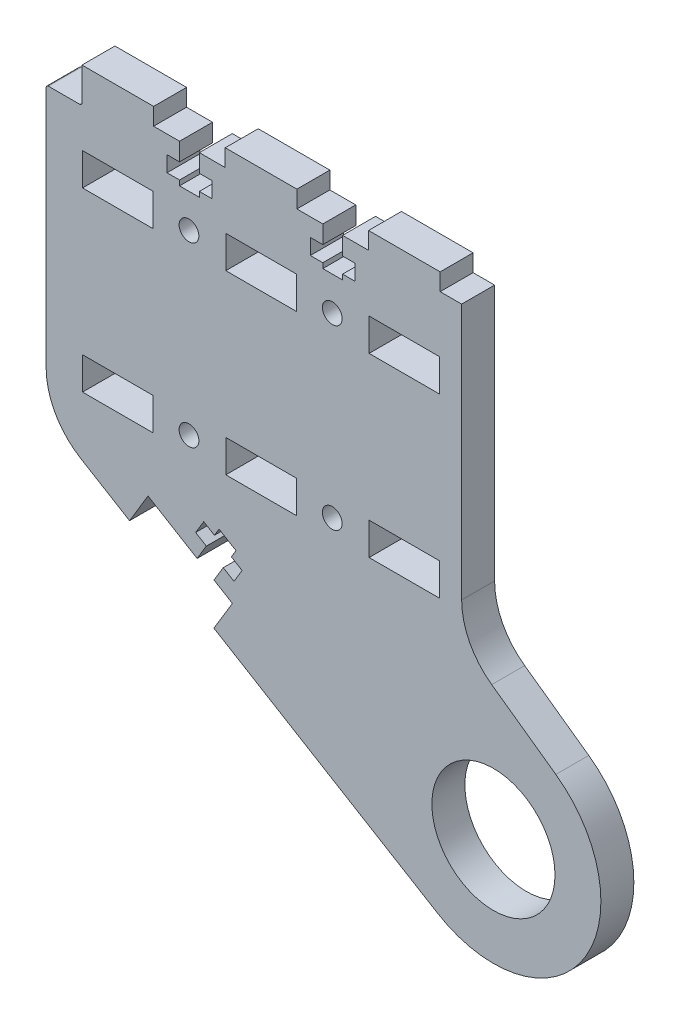
from build123d import *

# Parameters (mm, degrees)
SKETCH1_R           = 10.9125
SKETCH1_W           = 12.5
SKETCH1_H           = 5.742
SKETCH1_R_2         = 1.7526
BOSS_EXTRUDE1_DEPTH = 5.842
FILLET10_R          = 12.7
FILLET11_R          = 12.7
CUT_EXTRUDE9_DEPTH  = 93.478414179
FILLET12_R          = 12.7
SKETCH17_W          = 6.349990563
SKETCH17_H          = 3.175
CUT_EXTRUDE10_DEPTH = 93.478414179
FILLET13_R          = 0.4
CUT_EXTRUDE11_DEPTH = 93.478414179


with BuildPart() as part:
    # Sketch1 → Boss-Extrude1 (new body)
    with BuildSketch(Plane.XY):
        with BuildLine():
            Line((38.179644021, -25.196), (38.179644021, -12.853632574))
            Line((38.179644021, -12.853632574), (38.179644021, 12.853632574))
            Line((38.179644021, 12.853632574), (38.179644021, 28.575))
            Line((38.179644021, 28.575), (31.829653458, 28.575))
            Line((31.829653458, 28.575), (31.829653458, 31.623))
            Line((31.829653458, 31.623), (19.129653458, 31.623))
            Line((19.129653458, 31.623), (19.129653458, 28.575))
            Line((19.129653458, 28.575), (14.532253458, 28.575))
            Line((14.532253458, 28.575), (14.532253458, 25.4))
            Line((14.532253458, 25.4), (16.748403458, 25.4))
            Line((16.748403458, 25.4), (16.748403458, 22.621875))
            Line((16.748403458, 22.621875), (14.532253458, 22.621875))
            Line((14.532253458, 22.621875), (14.532253458, 21.717))
            Line((14.532253458, 21.717), (11.027053458, 21.717))
            Line((11.027053458, 21.717), (11.027053458, 22.621875))
            Line((11.027053458, 22.621875), (8.810903458, 22.621875))
            Line((8.810903458, 22.621875), (8.810903458, 25.4))
            Line((8.810903458, 25.4), (11.027053458, 25.4))
            Line((11.027053458, 25.4), (11.027053458, 28.575))
            Line((11.027053458, 28.575), (6.429653458, 28.575))
            Line((6.429653458, 28.575), (6.429653458, 31.623))
            Line((6.429653458, 31.623), (-6.270346542, 31.623))
            Line((-6.270346542, 31.623), (-6.270346542, 28.575))
            Line((-6.270346542, 28.575), (-10.867746542, 28.575))
            Line((-10.867746542, 28.575), (-10.867746542, 25.4))
            Line((-10.867746542, 25.4), (-8.651596542, 25.4))
            Line((-8.651596542, 25.4), (-8.651596542, 22.621875))
            Line((-8.651596542, 22.621875), (-10.867746542, 22.621875))
            Line((-10.867746542, 22.621875), (-10.867746542, 21.717))
            Line((-10.867746542, 21.717), (-14.372946542, 21.717))
            Line((-14.372946542, 21.717), (-14.372946542, 22.621875))
            Line((-14.372946542, 22.621875), (-16.589096542, 22.621875))
            Line((-16.589096542, 22.621875), (-16.589096542, 25.4))
            Line((-16.589096542, 25.4), (-14.372946542, 25.4))
            Line((-14.372946542, 25.4), (-14.372946542, 28.575))
            Line((-14.372946542, 28.575), (-18.970346542, 28.575))
            Line((-18.970346542, 28.575), (-18.970346542, 31.623))
            Line((-18.970346542, 31.623), (-31.670346542, 31.623))
            Line((-31.670346542, 31.623), (-31.670346542, 28.575))
            Line((-31.670346542, 28.575), (-38.020337105, 28.575))
            Line((-38.020337105, 28.575), (-38.020337105, 12.8))
            Line((-38.020337105, 12.8), (-38.020337105, -12.8))
            Line((-38.020337105, -12.8), (-38.020337105, -25.196))
            Line((-38.020337105, -25.196), (31.431988271, -67.1100466))
            ThreePointArc((31.431988271, -67.1100466), (57.197014599, -61.259060718), (52.334832344, -35.289274404))
            Line((52.334832344, -35.289274404), (38.179644021, -25.196))
        make_face()
        with Locations((41.275, -50.8)):
            Circle(SKETCH1_R, mode=Mode.SUBTRACT)
        with Locations((-25.320337105, -15.671)):
            Rectangle(SKETCH1_W, SKETCH1_H, mode=Mode.SUBTRACT)
        with Locations((-12.7, -15.721)):
            Circle(SKETCH1_R_2, mode=Mode.SUBTRACT)
        with Locations((0.079662895, -15.671)):
            Rectangle(SKETCH1_W, SKETCH1_H, mode=Mode.SUBTRACT)
        with Locations((-25.320337105, 15.671)):
            Rectangle(SKETCH1_W, SKETCH1_H, mode=Mode.SUBTRACT)
        with Locations((-12.7, 15.721)):
            Circle(SKETCH1_R_2, mode=Mode.SUBTRACT)
        with Locations((0.079662895, 15.671)):
            Rectangle(SKETCH1_W, SKETCH1_H, mode=Mode.SUBTRACT)
        with Locations((12.7, -15.721)):
            Circle(SKETCH1_R_2, mode=Mode.SUBTRACT)
        with Locations((25.479662895, -15.671)):
            Rectangle(SKETCH1_W, SKETCH1_H, mode=Mode.SUBTRACT)
        with Locations((12.7, 15.721)):
            Circle(SKETCH1_R_2, mode=Mode.SUBTRACT)
        with Locations((25.479662895, 15.671)):
            Rectangle(SKETCH1_W, SKETCH1_H, mode=Mode.SUBTRACT)
    extrude(amount=BOSS_EXTRUDE1_DEPTH)

    # Fillet10
    fillet10_edges = [part.edges().sort_by_distance(p)[0] for p in [
        (-38.020337105, -25.196, 2.921),
    ]]
    fillet(fillet10_edges, radius=FILLET10_R)

    # Fillet11
    fillet11_edges = [part.edges().sort_by_distance(p)[0] for p in [
        (38.179644021, -25.196, 2.921),
    ]]
    fillet(fillet11_edges, radius=FILLET11_R)

    # Sketch16 → Cut-Extrude9 (cut, through all)
    with BuildSketch(Plane(origin=(0, 0, 0), x_dir=(-1, 0, 0), z_dir=(0, 0, -1))):
        with BuildLine():
            Line((-35.639644021, 28.575), (-35.639644021, -23.384867827))
            Line((-35.639644021, -23.384867827), (-43.506422458, -28.99422827))
            ThreePointArc((-43.506422458, -28.99422827), (-39.589606071, -24.469674652), (-38.179644021, -18.653744539))
            Line((-38.179644021, -18.653744539), (-38.179644021, 28.575))
            Line((-38.179644021, 28.575), (-35.639644021, 28.575))
        make_face()
    extrude(amount=-CUT_EXTRUDE9_DEPTH, mode=Mode.SUBTRACT)

    # Fillet12
    fillet12_edges = [part.edges().sort_by_distance(p)[0] for p in [
        (35.639644021, -23.384867827, 2.921),
    ]]
    fillet(fillet12_edges, radius=FILLET12_R)

    # Sketch17 → Cut-Extrude10 (cut, through all)
    with BuildSketch(Plane.XY.offset(5.842)):
        with Locations((-34.845341824, 26.9875)):
            Rectangle(SKETCH17_W, SKETCH17_H)
    extrude(amount=-CUT_EXTRUDE10_DEPTH, mode=Mode.SUBTRACT)

    # Fillet13
    fillet13_edges = [part.edges().sort_by_distance(p)[0] for p in [
        (-38.020337105, 25.4, 2.921),
        (-31.670346542, 25.4, 2.921),
    ]]
    fillet(fillet13_edges, radius=FILLET13_R)

    # Sketch18 → Cut-Extrude11 (cut, through all)
    with BuildSketch(Plane.XY.offset(5.842)):
        Polygon((-23.234664807, -34.119061314), (-8.283788757, -43.141822065), (-5.002784847, -37.705139865), (-8.259357485, -35.739818523), (-6.61885553, -33.021477423), (-4.721453442, -34.166547787), (-3.286014232, -31.787999325), (-5.18341632, -30.64292896), (-4.363165342, -29.28375841), (-7.364213917, -27.472644252), (-8.184464894, -28.831814802), (-10.081866982, -27.686744438), (-11.517306193, -30.0652929), (-9.619904105, -31.210363265), (-11.26040606, -33.928704365), (-19.953660898, -28.682379113), align=None)
    extrude(amount=-CUT_EXTRUDE11_DEPTH, mode=Mode.SUBTRACT)


solid = part.part
